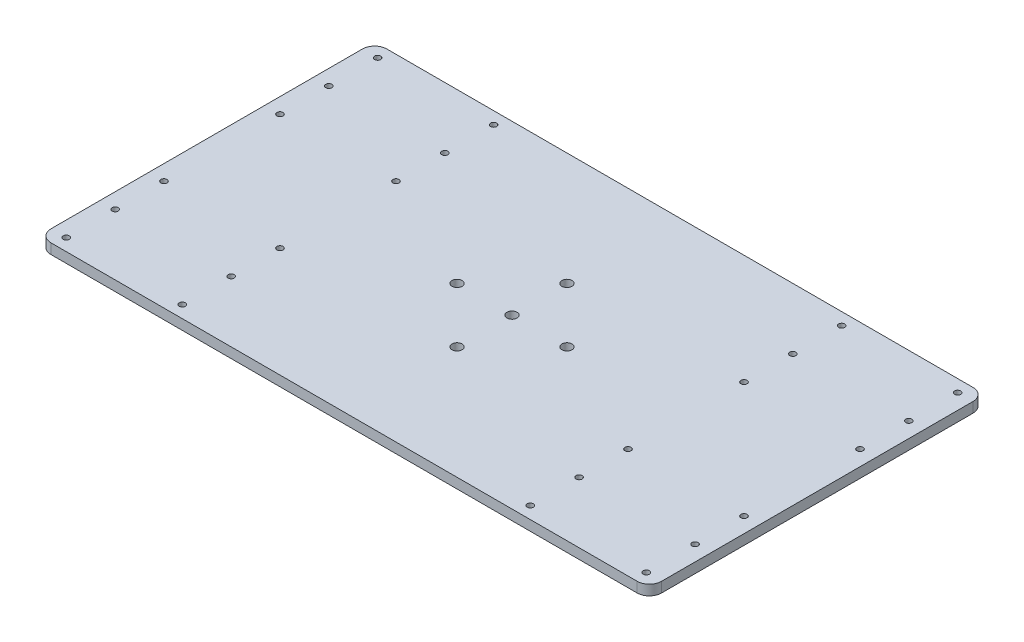
from build123d import *

# Parameters (mm, degrees)
SKETCH1_R           = 1.5
SKETCH1_R_2         = 2.5
BOSS_EXTRUDE1_DEPTH = 5


with BuildPart() as part:
    # Sketch1 → Boss-Extrude1 (new body)
    with BuildSketch(Plane(origin=(0, 0, 0), x_dir=(1, 0, 0), z_dir=(0, 1, 0))):
        with BuildLine():
            Line((-144, -82.5), (144, -82.5))
            ThreePointArc((144, -82.5), (148.242640687, -80.742640687), (150, -76.5))
            Line((150, -76.5), (150, 76.5))
            ThreePointArc((150, 76.5), (148.242640687, 80.742640687), (144, 82.5))
            Line((144, 82.5), (-144, 82.5))
            ThreePointArc((-144, 82.5), (-148.242640687, 80.742640687), (-150, 76.5))
            Line((-150, 76.5), (-150, -76.5))
            ThreePointArc((-150, -76.5), (-148.242640687, -80.742640687), (-144, -82.5))
        make_face()
        with Locations((-142.5, 76.5)):
            Circle(SKETCH1_R, mode=Mode.SUBTRACT)
        with Locations((-142.5, 52.5)):
            Circle(SKETCH1_R, mode=Mode.SUBTRACT)
        with Locations((-142.5, 28.5)):
            Circle(SKETCH1_R, mode=Mode.SUBTRACT)
        with Locations((-85.5, 76.5)):
            Circle(SKETCH1_R, mode=Mode.SUBTRACT)
        with Locations((-85.5, 52.5)):
            Circle(SKETCH1_R, mode=Mode.SUBTRACT)
        with Locations((-85.5, 28.5)):
            Circle(SKETCH1_R, mode=Mode.SUBTRACT)
        with Locations((85.5, 28.5)):
            Circle(SKETCH1_R, mode=Mode.SUBTRACT)
        with Locations((85.5, 52.5)):
            Circle(SKETCH1_R, mode=Mode.SUBTRACT)
        with Locations((85.5, 76.5)):
            Circle(SKETCH1_R, mode=Mode.SUBTRACT)
        with Locations((142.5, 28.5)):
            Circle(SKETCH1_R, mode=Mode.SUBTRACT)
        with Locations((142.5, 52.5)):
            Circle(SKETCH1_R, mode=Mode.SUBTRACT)
        with Locations((142.5, 76.5)):
            Circle(SKETCH1_R, mode=Mode.SUBTRACT)
        with Locations((142.5, -76.5)):
            Circle(SKETCH1_R, mode=Mode.SUBTRACT)
        with Locations((142.5, -52.5)):
            Circle(SKETCH1_R, mode=Mode.SUBTRACT)
        with Locations((142.5, -28.5)):
            Circle(SKETCH1_R, mode=Mode.SUBTRACT)
        with Locations((85.5, -76.5)):
            Circle(SKETCH1_R, mode=Mode.SUBTRACT)
        with Locations((85.5, -52.5)):
            Circle(SKETCH1_R, mode=Mode.SUBTRACT)
        with Locations((85.5, -28.5)):
            Circle(SKETCH1_R, mode=Mode.SUBTRACT)
        with Locations((-85.5, -28.5)):
            Circle(SKETCH1_R, mode=Mode.SUBTRACT)
        with Locations((-85.5, -52.5)):
            Circle(SKETCH1_R, mode=Mode.SUBTRACT)
        with Locations((-85.5, -76.5)):
            Circle(SKETCH1_R, mode=Mode.SUBTRACT)
        with Locations((-142.5, -28.5)):
            Circle(SKETCH1_R, mode=Mode.SUBTRACT)
        with Locations((-142.5, -52.5)):
            Circle(SKETCH1_R, mode=Mode.SUBTRACT)
        with Locations((-142.5, -76.5)):
            Circle(SKETCH1_R, mode=Mode.SUBTRACT)
        with Locations((0, 27)):
            Circle(SKETCH1_R_2, mode=Mode.SUBTRACT)
        with Locations((27, 0)):
            Circle(SKETCH1_R_2, mode=Mode.SUBTRACT)
        with Locations((0, -27)):
            Circle(SKETCH1_R_2, mode=Mode.SUBTRACT)
        with Locations((-27, 0)):
            Circle(SKETCH1_R_2, mode=Mode.SUBTRACT)
        Circle(SKETCH1_R_2, mode=Mode.SUBTRACT)
    extrude(amount=BOSS_EXTRUDE1_DEPTH)


solid = part.part
